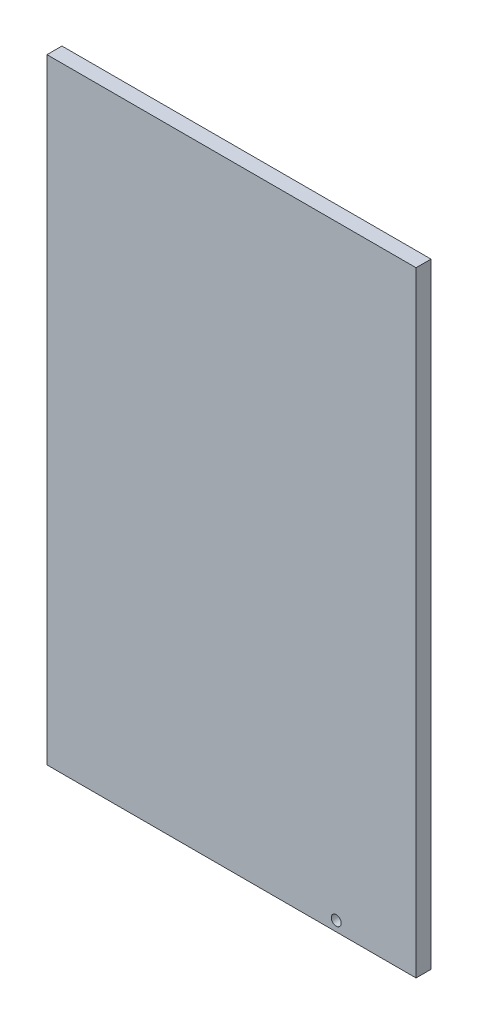
from build123d import *

# Parameters (mm, degrees)
SKETCH1_W           = 222
SKETCH1_H           = 370
BOSS_EXTRUDE1_DEPTH = 9
SKETCH2_R           = 3
CUT_EXTRUDE1_DEPTH  = 216.932859936


with BuildPart() as part:
    # Sketch1 → Boss-Extrude1 (new body)
    with BuildSketch(Plane.XY):
        Rectangle(SKETCH1_W, SKETCH1_H)
    extrude(amount=BOSS_EXTRUDE1_DEPTH)

    # Sketch2 → Cut-Extrude1 (cut, through all)
    with BuildSketch(Plane.XY.offset(9)):
        with Locations((63, -179)):
            Circle(SKETCH2_R)
    extrude(amount=-CUT_EXTRUDE1_DEPTH, mode=Mode.SUBTRACT)


solid = part.part
